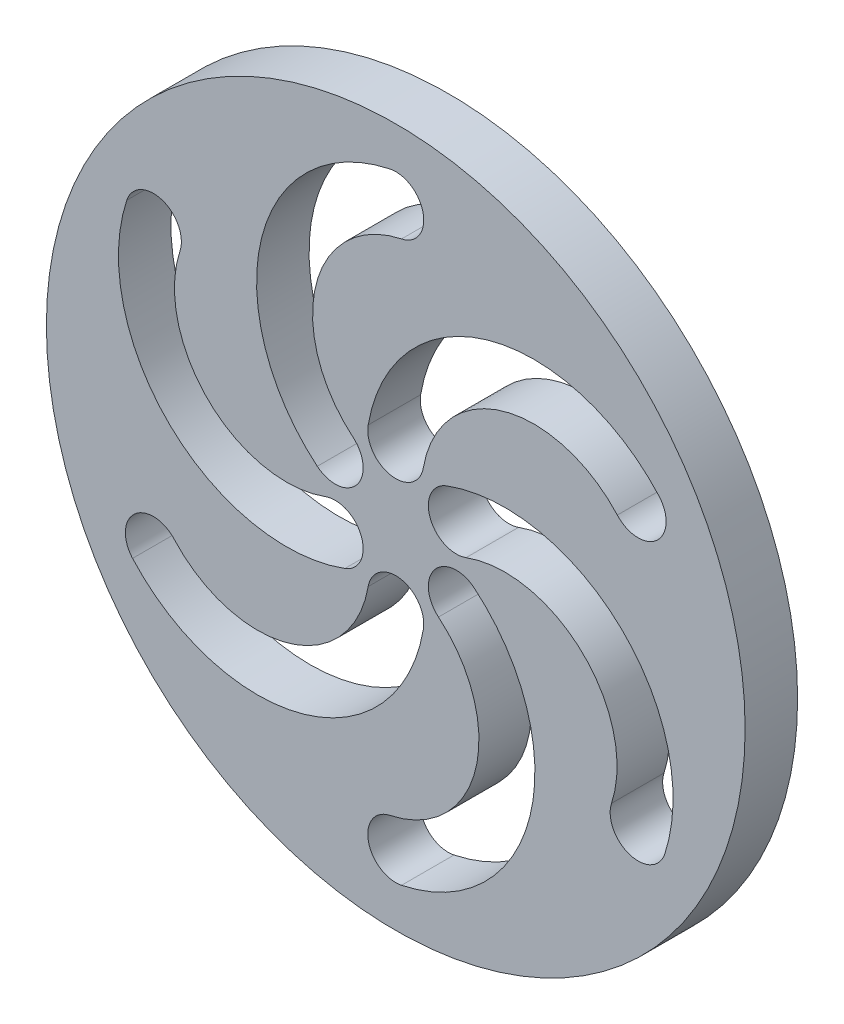
from build123d import *

# Parameters (mm, degrees)
SKETCH1_R           = 31.706189334
BOSS_EXTRUDE1_DEPTH = 4.7625


with BuildPart() as part:
    # Sketch1 → Boss-Extrude1 (new body)
    with BuildSketch(Plane.XY):
        Circle(SKETCH1_R)
        with BuildLine():
            ThreePointArc((2.503525325, 5.921093311), (-0.428906689, 3.846474675), (-2.503525325, 6.778906689))
            ThreePointArc((-2.503525325, 6.778906689), (8.303294949, 18.861542556), (23.886831861, 14.397146601))
            ThreePointArc((23.886831861, 14.397146601), (23.694191858, 10.810213395), (20.107258651, 11.002853399))
            ThreePointArc((20.107258651, 11.002853399), (9.712233447, 13.980836428), (2.503525325, 5.921093311))
        make_face(mode=Mode.SUBTRACT)
        with BuildLine():
            ThreePointArc((4.61894274, 5.557569875), (20.486222483, 2.239906917), (24.41171063, -13.488029907))
            ThreePointArc((24.41171063, -13.488029907), (21.209015349, -15.114665373), (19.582379883, -11.911970093))
            ThreePointArc((19.582379883, -11.911970093), (16.963876237, -1.420622679), (6.379579888, 0.792430125))
            ThreePointArc((6.379579888, 0.792430125), (3.116691439, 2.294681426), (4.61894274, 5.557569875))
        make_face(mode=Mode.SUBTRACT)
        with BuildLine():
            ThreePointArc((7.122468065, -1.221336814), (12.182927534, -16.621635639), (0.524878768, -27.885176509))
            ThreePointArc((0.524878768, -27.885176509), (-2.485176509, -25.924878768), (-0.524878768, -22.914823491))
            ThreePointArc((-0.524878768, -22.914823491), (7.251642789, -15.401459107), (3.876054563, -5.128663186))
            ThreePointArc((3.876054563, -5.128663186), (3.545598128, -1.551793249), (7.122468065, -1.221336814))
        make_face(mode=Mode.SUBTRACT)
        with BuildLine():
            ThreePointArc((2.503525325, -6.778906689), (-8.303294949, -18.861542556), (-23.886831861, -14.397146601))
            ThreePointArc((-23.886831861, -14.397146601), (-23.694191858, -10.810213395), (-20.107258651, -11.002853399))
            ThreePointArc((-20.107258651, -11.002853399), (-9.712233447, -13.980836428), (-2.503525325, -5.921093311))
            ThreePointArc((-2.503525325, -5.921093311), (0.428906689, -3.846474675), (2.503525325, -6.778906689))
        make_face(mode=Mode.SUBTRACT)
        with BuildLine():
            ThreePointArc((-4.61894274, -5.557569875), (-20.486222483, -2.239906917), (-24.41171063, 13.488029907))
            ThreePointArc((-24.41171063, 13.488029907), (-21.209015349, 15.114665373), (-19.582379883, 11.911970093))
            ThreePointArc((-19.582379883, 11.911970093), (-16.963876237, 1.420622679), (-6.379579888, -0.792430125))
            ThreePointArc((-6.379579888, -0.792430125), (-3.116691439, -2.294681426), (-4.61894274, -5.557569875))
        make_face(mode=Mode.SUBTRACT)
        with BuildLine():
            ThreePointArc((-7.122468065, 1.221336814), (-12.182927534, 16.621635639), (-0.524878768, 27.885176509))
            ThreePointArc((-0.524878768, 27.885176509), (2.485176509, 25.924878768), (0.524878768, 22.914823491))
            ThreePointArc((0.524878768, 22.914823491), (-7.251642789, 15.401459107), (-3.876054563, 5.128663186))
            ThreePointArc((-3.876054563, 5.128663186), (-3.545598128, 1.551793249), (-7.122468065, 1.221336814))
        make_face(mode=Mode.SUBTRACT)
    extrude(amount=BOSS_EXTRUDE1_DEPTH)


solid = part.part
